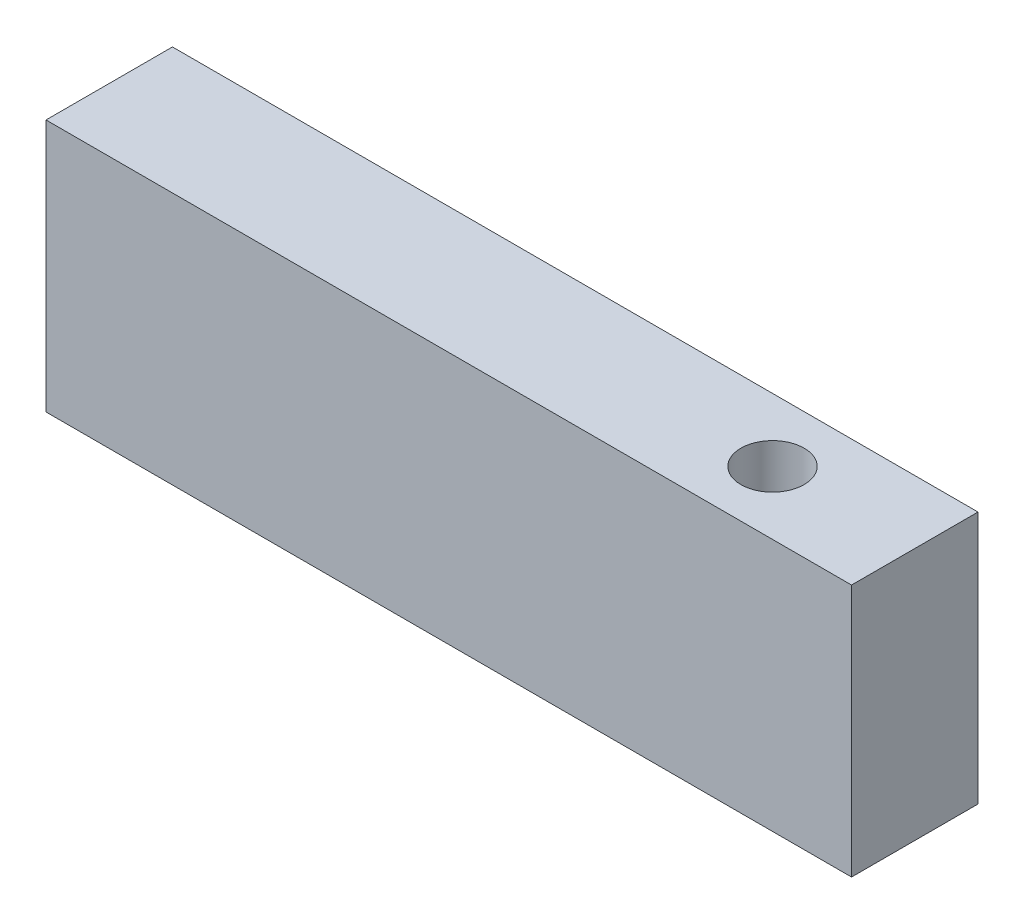
from build123d import *

# Parameters (mm, degrees)
SKETCH1_W           = 161.798
SKETCH1_H           = 50.8
BOSS_EXTRUDE1_DEPTH = 25.4
SKETCH2_R           = 6.35
CUT_EXTRUDE1_DEPTH  = 381


with BuildPart() as part:
    # Sketch1 → Boss-Extrude1 (new body)
    with BuildSketch(Plane.XY):
        with Locations((80.899, 25.4)):
            Rectangle(SKETCH1_W, SKETCH1_H)
    extrude(amount=BOSS_EXTRUDE1_DEPTH)

    # Sketch2 → Cut-Extrude1 (cut)
    with BuildSketch(Plane(origin=(0, 50.8, 0), x_dir=(1, 0, 0), z_dir=(0, 1, 0))):
        with Locations((133.223, -12.7)):
            Circle(SKETCH2_R)
    extrude(amount=-CUT_EXTRUDE1_DEPTH, mode=Mode.SUBTRACT)


solid = part.part
